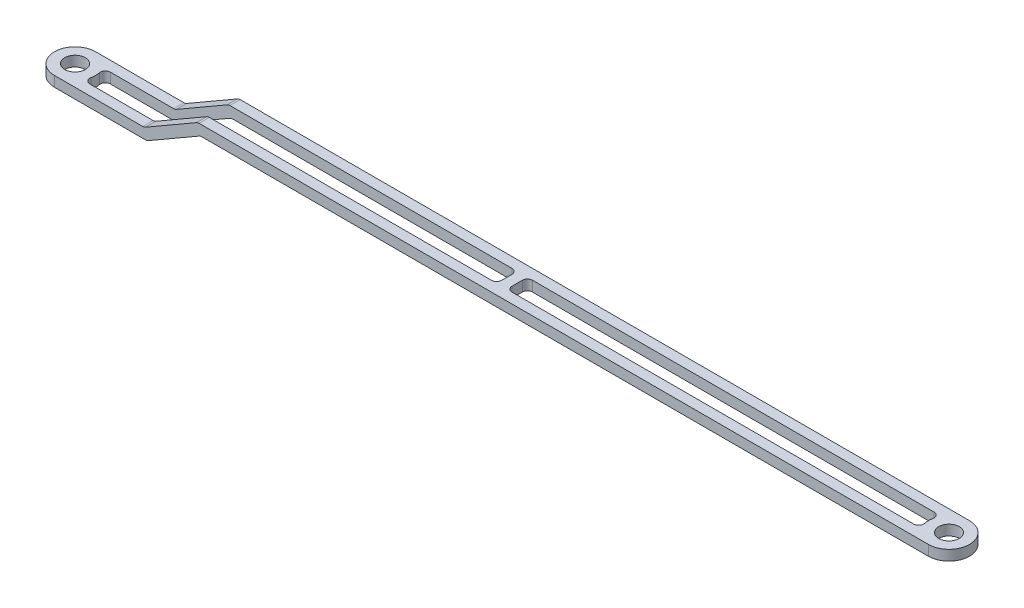
from build123d import *

# Parameters (mm, degrees)
SKETCH1_R           = 2
BOSS_EXTRUDE1_DEPTH = 8
CUT_EXTRUDE1_DEPTH  = 8
FILLET1_R           = 1


with BuildPart() as part:
    # Sketch1 → Boss-Extrude1 (new body)
    with BuildSketch(Plane(origin=(0, 0, 0), x_dir=(1, 0, 0), z_dir=(0, 1, 0))):
        with BuildLine():
            ThreePointArc((0, 4), (-4, 0), (0, -4))
            Line((0, -4), (170, -4))
            ThreePointArc((170, -4), (174, 0), (170, 4))
            Line((170, 4), (0, 4))
        make_face()
        Circle(SKETCH1_R, mode=Mode.SUBTRACT)
        with BuildLine():
            Line((86, 2), (166.535898385, 2))
            ThreePointArc((166.535898385, 2), (166, 0), (166.535898385, -2))
            Line((166.535898385, -2), (86, -2))
            Line((86, -2), (86, 2))
        make_face(mode=Mode.SUBTRACT)
        with BuildLine():
            Line((3.464101615, 2), (84, 2))
            Line((84, 2), (84, -2))
            Line((84, -2), (3.464101615, -2))
            ThreePointArc((3.464101615, -2), (4, 0), (3.464101615, 2))
        make_face(mode=Mode.SUBTRACT)
        with Locations((170, 0)):
            Circle(SKETCH1_R, mode=Mode.SUBTRACT)
    extrude(amount=BOSS_EXTRUDE1_DEPTH)

    # Sketch2 → Cut-Extrude1 (cut)
    with BuildSketch(Plane.XY.offset(4)):
        Polygon((-4, 8), (-4, 2), (17.464101615, 2), (27.856406461, 8), align=None)
        Polygon((28.392304845, 6), (18, 0), (174, 0), (174, 6), align=None)
    extrude(amount=-CUT_EXTRUDE1_DEPTH, mode=Mode.SUBTRACT)

    # Fillet1
    fillet1_edges = [part.edges().sort_by_distance(p)[0] for p in [
        (166.535898385, 7, -2),
        (166.535898385, 7, 2),
        (86, 7, 2),
        (84, 7, 2),
        (86, 7, -2),
        (84, 7, -2),
        (28.392304845, 6, -3),
        (27.856406461, 8, -3),
        (28.392304845, 6, 3),
        (27.856406461, 8, 3),
        (18, 0, -3),
        (18, 0, 3),
        (17.464101615, 2, 3),
        (17.464101615, 2, -3),
        (3.464101615, 1, 2),
        (3.464101615, 1, -2),
    ]]
    fillet(fillet1_edges, radius=FILLET1_R)


solid = part.part
